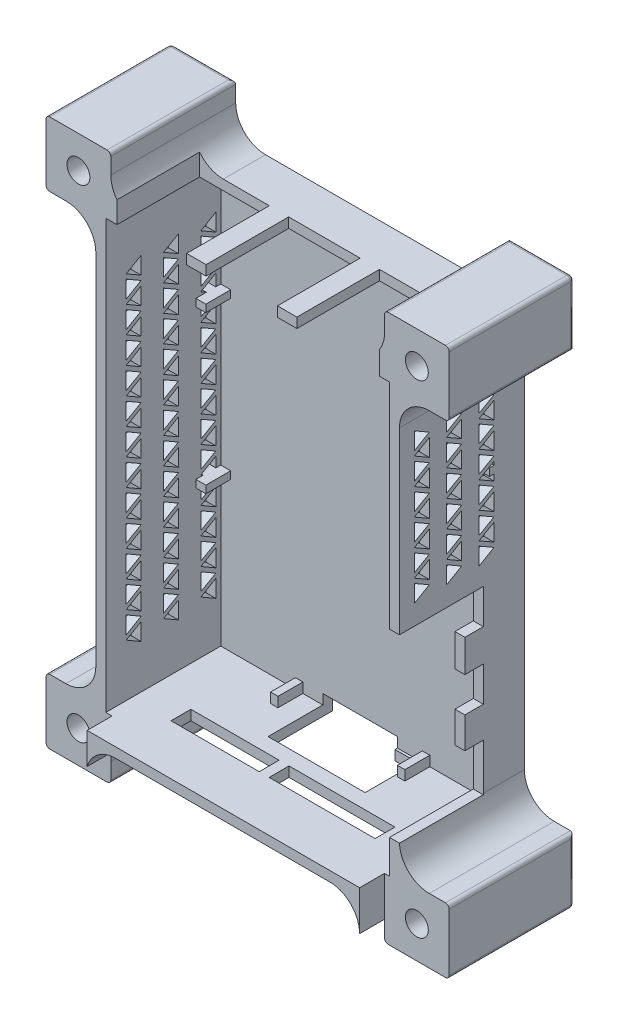
from build123d import *

# Parameters (mm, degrees)
SKETCH1_W            = 61
SKETCH1_H            = 90
BOSS_EXTRUDE1_DEPTH  = 2
SKETCH2_W            = 61
SKETCH2_H            = 90
SKETCH2_W_2          = 57
SKETCH2_H_2          = 86
BOSS_EXTRUDE2_DEPTH  = 6.6
SKETCH3_W            = 1.5
SKETCH3_H            = 2
SKETCH3_W_2          = 2
SKETCH3_H_2          = 1.5
BOSS_EXTRUDE3_DEPTH  = 5
SKETCH4_W            = 61
SKETCH4_H            = 90
SKETCH4_W_2          = 57
SKETCH4_H_2          = 86
BOSS_EXTRUDE4_DEPTH  = 16.5
SKETCH5_W            = 14.35
SKETCH5_H            = 16.6
SKETCH5_W_2          = 14
CUT_EXTRUDE1_DEPTH   = 2
SKETCH8_W            = 19.5
SKETCH8_H            = 10.5
SKETCH8_W_2          = 17.719958389
SKETCH8_H_2          = 4
SKETCH8_W_3          = 21.280041611
CUT_EXTRUDE3_DEPTH   = 2
CUT_EXTRUDE22_DEPTH  = 2
SKETCH10_W           = 61
SKETCH10_H           = 2
BOSS_EXTRUDE5_DEPTH  = 5
SKETCH20_W           = 13
SKETCH20_H           = 13
BOSS_EXTRUDE8_DEPTH  = 25.1
SKETCH25_W           = 13
SKETCH25_H           = 13
SKETCH25_W_2         = 0.25
CUT_EXTRUDE11_DEPTH  = 126.183904716
SKETCH26_W           = 1
SKETCH26_H           = 1
CUT_EXTRUDE12_DEPTH  = 23.1
SKETCH27_R           = 2.3
CUT_EXTRUDE13_DEPTH  = 126.183904716
CUT_EXTRUDE17_DEPTH  = 6
FILLET3_R            = 6
FILLET7_R            = 6
BOSS_EXTRUDE11_DEPTH = 25.1
SKETCH35_R           = 2.3
CUT_EXTRUDE18_DEPTH  = 126.183904716
FILLET10_R           = 6
FILLET13_R           = 0.75
CUT_EXTRUDE19_DEPTH  = 6
SKETCH38_W           = 11
SKETCH38_H           = 11
CUT_EXTRUDE20_DEPTH  = 10
FILLET14_R           = 6
SKETCH39_W           = 15
SKETCH39_H           = 2.5
CUT_EXTRUDE21_DEPTH  = 4
FILLET17_R           = 6
FILLET18_R           = 6
SKETCH43_W           = 3
SKETCH43_H           = 1.5
BOSS_EXTRUDE15_DEPTH = 2
CUT_EXTRUDE23_DEPTH  = 2
SKETCH44_W           = 0.9
SKETCH44_H           = 1.5
BOSS_EXTRUDE16_DEPTH = 2
FILLET19_R           = 6
FILLET20_R           = 6


with BuildPart() as part:
    # Sketch1 → Boss-Extrude1 (new body)
    with BuildSketch(Plane.XY):
        with Locations((30.5, 45)):
            Rectangle(SKETCH1_W, SKETCH1_H)
    extrude(amount=BOSS_EXTRUDE1_DEPTH)

    # Sketch2 → Boss-Extrude2 (add)
    with BuildSketch(Plane.XY.offset(2)):
        with Locations((30.5, 45)):
            Rectangle(SKETCH2_W, SKETCH2_H)
        with Locations((30.5, 45)):
            Rectangle(SKETCH2_W_2, SKETCH2_H_2, mode=Mode.SUBTRACT)
    extrude(amount=BOSS_EXTRUDE2_DEPTH)

    # Sketch3 → Boss-Extrude3 (add)
    with BuildSketch(Plane.XY.offset(2)):
        with Locations((43.25, 3)):
            Rectangle(SKETCH3_W, SKETCH3_H)
        with Locations((17.75, 3)):
            Rectangle(SKETCH3_W, SKETCH3_H)
        with Locations((3, 32.75)):
            Rectangle(SKETCH3_W_2, SKETCH3_H_2)
        with Locations((58, 32.75)):
            Rectangle(SKETCH3_W_2, SKETCH3_H_2)
        with Locations((58, 64.25)):
            Rectangle(SKETCH3_W_2, SKETCH3_H_2)
        with Locations((3, 64.25)):
            Rectangle(SKETCH3_W_2, SKETCH3_H_2)
    extrude(amount=BOSS_EXTRUDE3_DEPTH)

    # Sketch4 → Boss-Extrude4 (add)
    with BuildSketch(Plane.XY.offset(8.6)):
        with Locations((30.5, 45)):
            Rectangle(SKETCH4_W, SKETCH4_H)
        with Locations((30.5, 45)):
            Rectangle(SKETCH4_W_2, SKETCH4_H_2, mode=Mode.SUBTRACT)
    extrude(amount=BOSS_EXTRUDE4_DEPTH)

    # Sketch5 → Cut-Extrude1 (cut)
    with BuildSketch(Plane(origin=(0, 90, 0), x_dir=(1, 0, 0), z_dir=(0, 1, 0))):
        Polygon((57, -8.5), (40.4, -8.5), (40.4, -22.25), (40.4, -25.1), (57, -25.1), align=None)
        with Locations((29.325, -16.8)):
            Rectangle(SKETCH5_W, SKETCH5_H)
        with Locations((11.25, -16.8)):
            Rectangle(SKETCH5_W_2, SKETCH5_H)
    extrude(amount=-CUT_EXTRUDE1_DEPTH, mode=Mode.SUBTRACT)

    # Sketch8 → Cut-Extrude3 (cut)
    with BuildSketch(Plane(origin=(0, 0, 0), x_dir=(-1, 0, 0), z_dir=(0, -1, 0))):
        with Locations((-32.25, -7.75)):
            Rectangle(SKETCH8_W, SKETCH8_H)
        with Locations((-18.859979194, -18)):
            Rectangle(SKETCH8_W_2, SKETCH8_H_2)
        with Locations((-40.359979194, -18)):
            Rectangle(SKETCH8_W_3, SKETCH8_H_2)
    extrude(amount=-CUT_EXTRUDE3_DEPTH, mode=Mode.SUBTRACT)

    # Sketch9 → Cut-Extrude22 (cut)
    with BuildSketch(Plane.ZY):
        Polygon((3, 78), (6, 76.267949192), (3, 74.535898385), align=None)
        Polygon((3, 73.612137954), (6, 75.344188762), (6, 71.880087147), align=None)
        Polygon((10.5, 74.535898385), (10.5, 78), (13.5, 76.267949192), align=None)
        Polygon((13.5, 71.880087147), (10.5, 73.612137954), (13.5, 75.344188762), align=None)
        Polygon((18, 74.535898385), (18, 78), (21, 76.267949192), align=None)
        Polygon((21, 71.880087147), (18, 73.612137954), (21, 75.344188762), align=None)
        Polygon((10.5, 69.224275908), (10.5, 72.688377523), (13.5, 70.956326716), align=None)
        Polygon((13.5, 66.56846467), (10.5, 68.300515478), (13.5, 70.032566285), align=None)
        Polygon((18, 69.224275908), (18, 72.688377523), (21, 70.956326716), align=None)
        Polygon((21, 66.56846467), (18, 68.300515478), (21, 70.032566285), align=None)
        Polygon((10.5, 63.912653432), (10.5, 67.376755047), (13.5, 65.644704239), align=None)
        Polygon((13.5, 61.256842194), (10.5, 62.988893001), (13.5, 64.720943809), align=None)
        Polygon((18, 63.912653432), (18, 67.376755047), (21, 65.644704239), align=None)
        Polygon((21, 61.256842194), (18, 62.988893001), (21, 64.720943809), align=None)
        Polygon((10.5, 58.601030955), (10.5, 62.06513257), (13.5, 60.333081763), align=None)
        Polygon((13.5, 55.945219717), (10.5, 57.677270525), (13.5, 59.409321332), align=None)
        Polygon((18, 58.601030955), (18, 62.06513257), (21, 60.333081763), align=None)
        Polygon((21, 55.945219717), (18, 57.677270525), (21, 59.409321332), align=None)
        Polygon((10.5, 53.289408479), (10.5, 56.753510094), (13.5, 55.021459286), align=None)
        Polygon((13.5, 50.63359724), (10.5, 52.365648048), (13.5, 54.097698856), align=None)
        Polygon((18, 53.289408479), (18, 56.753510094), (21, 55.021459286), align=None)
        Polygon((21, 50.63359724), (18, 52.365648048), (21, 54.097698856), align=None)
        Polygon((10.5, 47.977786002), (10.5, 51.441887617), (13.5, 49.70983681), align=None)
        Polygon((13.5, 45.321974764), (10.5, 47.054025571), (13.5, 48.786076379), align=None)
        Polygon((18, 47.977786002), (18, 51.441887617), (21, 49.70983681), align=None)
        Polygon((21, 45.321974764), (18, 47.054025571), (21, 48.786076379), align=None)
        Polygon((10.5, 42.666163526), (10.5, 46.130265141), (13.5, 44.398214333), align=None)
        Polygon((13.5, 40.010352287), (10.5, 41.742403095), (13.5, 43.474453902), align=None)
        Polygon((18, 42.666163526), (18, 46.130265141), (21, 44.398214333), align=None)
        Polygon((21, 40.010352287), (18, 41.742403095), (21, 43.474453902), align=None)
        Polygon((10.5, 37.354541049), (10.5, 40.818642664), (13.5, 39.086591857), align=None)
        Polygon((13.5, 34.698729811), (10.5, 36.430780618), (13.5, 38.162831426), align=None)
        Polygon((18, 37.354541049), (18, 40.818642664), (21, 39.086591857), align=None)
        Polygon((21, 34.698729811), (18, 36.430780618), (21, 38.162831426), align=None)
        Polygon((10.5, 32.042918573), (10.5, 35.507020188), (13.5, 33.77496938), align=None)
        Polygon((13.5, 29.387107334), (10.5, 31.119158142), (13.5, 32.851208949), align=None)
        Polygon((18, 32.042918573), (18, 35.507020188), (21, 33.77496938), align=None)
        Polygon((21, 29.387107334), (18, 31.119158142), (21, 32.851208949), align=None)
        Polygon((10.5, 26.731296096), (10.5, 30.195397711), (13.5, 28.463346904), align=None)
        Polygon((13.5, 24.075484858), (10.5, 25.807535665), (13.5, 27.539586473), align=None)
        Polygon((18, 26.731296096), (18, 30.195397711), (21, 28.463346904), align=None)
        Polygon((21, 24.075484858), (18, 25.807535665), (21, 27.539586473), align=None)
        Polygon((10.5, 21.419673619), (10.5, 24.883775235), (13.5, 23.151724427), align=None)
        Polygon((13.5, 18.763862381), (10.5, 20.495913189), (13.5, 22.227963996), align=None)
        Polygon((18, 21.419673619), (18, 24.883775235), (21, 23.151724427), align=None)
        Polygon((21, 18.763862381), (18, 20.495913189), (21, 22.227963996), align=None)
        Polygon((10.5, 16.108051143), (10.5, 19.572152758), (13.5, 17.84010195), align=None)
        Polygon((13.5, 13.452239905), (10.5, 15.184290712), (13.5, 16.91634152), align=None)
        Polygon((18, 16.108051143), (18, 19.572152758), (21, 17.84010195), align=None)
        Polygon((21, 13.452239905), (18, 15.184290712), (21, 16.91634152), align=None)
        Polygon((10.5, 10.796428666), (10.5, 14.260530281), (13.5, 12.528479474), align=None)
        Polygon((18, 10.796428666), (18, 14.260530281), (21, 12.528479474), align=None)
        Polygon((3, 69.224275908), (3, 72.688377523), (6, 70.956326716), align=None)
        Polygon((6, 66.56846467), (3, 68.300515478), (6, 70.032566285), align=None)
        Polygon((3, 63.912653432), (3, 67.376755047), (6, 65.644704239), align=None)
        Polygon((6, 61.256842194), (3, 62.988893001), (6, 64.720943809), align=None)
        Polygon((3, 58.601030955), (3, 62.06513257), (6, 60.333081763), align=None)
        Polygon((6, 55.945219717), (3, 57.677270525), (6, 59.409321332), align=None)
        Polygon((3, 53.289408479), (3, 56.753510094), (6, 55.021459286), align=None)
        Polygon((6, 50.63359724), (3, 52.365648048), (6, 54.097698856), align=None)
        Polygon((3, 47.977786002), (3, 51.441887617), (6, 49.70983681), align=None)
        Polygon((6, 45.321974764), (3, 47.054025571), (6, 48.786076379), align=None)
        Polygon((3, 42.666163526), (3, 46.130265141), (6, 44.398214333), align=None)
        Polygon((6, 40.010352287), (3, 41.742403095), (6, 43.474453902), align=None)
        Polygon((3, 37.354541049), (3, 40.818642664), (6, 39.086591857), align=None)
        Polygon((6, 34.698729811), (3, 36.430780618), (6, 38.162831426), align=None)
        Polygon((3, 32.042918573), (3, 35.507020188), (6, 33.77496938), align=None)
        Polygon((6, 29.387107334), (3, 31.119158142), (6, 32.851208949), align=None)
        Polygon((3, 26.731296096), (3, 30.195397711), (6, 28.463346904), align=None)
        Polygon((6, 24.075484858), (3, 25.807535665), (6, 27.539586473), align=None)
        Polygon((3, 21.419673619), (3, 24.883775235), (6, 23.151724427), align=None)
        Polygon((6, 18.763862381), (3, 20.495913189), (6, 22.227963996), align=None)
        Polygon((3, 16.108051143), (3, 19.572152758), (6, 17.84010195), align=None)
        Polygon((6, 13.452239905), (3, 15.184290712), (6, 16.91634152), align=None)
        Polygon((3, 10.796428666), (3, 14.260530281), (6, 12.528479474), align=None)
    extrude(amount=-CUT_EXTRUDE22_DEPTH, mode=Mode.SUBTRACT)

    # Sketch10 → Boss-Extrude5 (add)
    with BuildSketch(Plane.XY.offset(25.1)):
        with Locations((30.5, 1)):
            Rectangle(SKETCH10_W, SKETCH10_H)
    extrude(amount=BOSS_EXTRUDE5_DEPTH)

    # Sketch20 → Boss-Extrude8 (add)
    with BuildSketch(Plane(origin=(0, 0, 0), x_dir=(-1, 0, 0), z_dir=(0, 0, -1))):
        with Locations((3.5, -3.5)):
            Rectangle(SKETCH20_W, SKETCH20_H)
        with Locations((-64.5, 93.5)):
            Rectangle(SKETCH20_W, SKETCH20_H)
    extrude(amount=-BOSS_EXTRUDE8_DEPTH)

    # Sketch25 → Cut-Extrude11 (cut, through all)
    with BuildSketch(Plane.XY.offset(25.1)):
        with Locations((-3.5, -3.5)):
            Rectangle(SKETCH25_W, SKETCH25_H)
        with Locations((3.125, -3.5)):
            Rectangle(SKETCH25_W_2, SKETCH25_H)
    extrude(amount=CUT_EXTRUDE11_DEPTH, mode=Mode.SUBTRACT)

    # Sketch26 → Cut-Extrude12 (cut)
    with BuildSketch(Plane.XY.offset(25.1)):
        with Locations((2.5, 2.5)):
            Rectangle(SKETCH26_W, SKETCH26_H)
        with Locations((58.5, 87.5)):
            Rectangle(SKETCH26_W, SKETCH26_H)
    extrude(amount=-CUT_EXTRUDE12_DEPTH, mode=Mode.SUBTRACT)

    # Sketch27 → Cut-Extrude13 (cut, through all)
    with BuildSketch(Plane.XY.offset(25.1)):
        with Locations((-3.5, -3.5)):
            Circle(SKETCH27_R)
        with Locations((64.5, 93.5)):
            Circle(SKETCH27_R)
    extrude(amount=-CUT_EXTRUDE13_DEPTH, mode=Mode.SUBTRACT)

    # Sketch31 → Cut-Extrude17 (cut)
    with BuildSketch(Plane(origin=(0, 0, 0), x_dir=(-1, 0, 0), z_dir=(0, 0, -1))):
        Polygon((-61.873056275, 88.95), (-59.24611255, 93.5), (-61.873056275, 98.05), (-67.126943725, 98.05), (-69.75388745, 93.5), (-67.126943725, 88.95), align=None)
        Polygon((6.126943725, -8.05), (8.75388745, -3.5), (6.126943725, 1.05), (0.873056275, 1.05), (-1.75388745, -3.5), (0.873056275, -8.05), align=None)
    extrude(amount=-CUT_EXTRUDE17_DEPTH, mode=Mode.SUBTRACT)

    # Fillet3
    fillet3_edges = [part.edges().sort_by_distance(p)[0] for p in [
        (58, 90, 12.55),
    ]]
    fillet(fillet3_edges, radius=FILLET3_R)

    # Fillet7
    fillet7_edges = [part.edges().sort_by_distance(p)[0] for p in [
        (3, 0, 12.55),
    ]]
    fillet(fillet7_edges, radius=FILLET7_R)

    # Sketch34 → Boss-Extrude11 (add)
    with BuildSketch(Plane.XY.offset(25.1)):
        Polygon((59, 3), (71, 3), (71, -10), (58, -10), (58, 2), (59, 2), align=None)
        Polygon((2, 87), (-10, 87), (-10, 100), (3, 100), (3, 88), (2, 88), align=None)
    extrude(amount=-BOSS_EXTRUDE11_DEPTH)

    # Sketch35 → Cut-Extrude18 (cut, through all)
    with BuildSketch(Plane.XY.offset(25.1)):
        with Locations((-3.5, 93.5)):
            Circle(SKETCH35_R)
        with Locations((64.5, -3.5)):
            Circle(SKETCH35_R)
    extrude(amount=-CUT_EXTRUDE18_DEPTH, mode=Mode.SUBTRACT)

    # Fillet10
    fillet10_edges = [part.edges().sort_by_distance(p)[0] for p in [
        (3, 90, 12.55),
    ]]
    fillet(fillet10_edges, radius=FILLET10_R)

    # Fillet13
    fillet13_edges = [part.edges().sort_by_distance(p)[0] for p in [
        (3, -10, 12.55),
        (-3.5, -10, 0),
        (-10, -3.5, 0),
        (-10, -10, 12.55),
        (-10, 3, 12.55),
        (58, 100, 12.55),
        (64.5, 100, 0),
        (71, 93.5, 0),
        (71, 100, 12.55),
        (71, 87, 12.55),
        (58, -10, 12.55),
        (64.5, -10, 0),
        (71, -10, 12.55),
        (71, -3.5, 0),
        (71, 3, 12.55),
        (3, 100, 12.55),
        (-3.5, 100, 0),
        (-10, 100, 12.55),
        (-10, 93.5, 0),
        (-10, 87, 12.55),
    ]]
    fillet(fillet13_edges, radius=FILLET13_R)

    # Sketch36 → Cut-Extrude19 (cut)
    with BuildSketch(Plane(origin=(0, 0, 0), x_dir=(-1, 0, 0), z_dir=(0, 0, -1))):
        Polygon((-59.24611255, -3.5), (-61.873056275, 1.05), (-67.126943725, 1.05), (-69.75388745, -3.5), (-67.126943725, -8.05), (-61.873056275, -8.05), align=None)
        Polygon((-1.75388745, 93.5), (0.873056275, 88.95), (6.126943725, 88.95), (8.75388745, 93.5), (6.126943725, 98.05), (0.873056275, 98.05), align=None)
    extrude(amount=-CUT_EXTRUDE19_DEPTH, mode=Mode.SUBTRACT)

    # Sketch38 → Cut-Extrude20 (cut)
    with BuildSketch(Plane.XY.offset(25.1)):
        with Locations((63.5, -2.5)):
            Rectangle(SKETCH38_W, SKETCH38_H)
    extrude(amount=CUT_EXTRUDE20_DEPTH, mode=Mode.SUBTRACT)

    # Fillet14
    # the kernel refuses this fillet: 6 mm, written as the material it adds along each edge
    with BuildSketch(Plane(origin=(58, 0, 40.1), x_dir=(0, -1, 0), z_dir=(0, 0, -1))) as fillet14_piece_1_section:
        with BuildLine():
            CenterArc((FILLET14_R, FILLET14_R), FILLET14_R, 180, 90)
            Line((0, FILLET14_R), (0, 0))
            Line((0, 0), (FILLET14_R, 0))
        make_face()
    fillet14_piece_1 = extrude(amount=40.1, mode=Mode.PRIVATE)
    fillet14_piece_1 = split(fillet14_piece_1, bisect_by=Plane(origin=(56.518293699, -1.220838778, 25.1), z_dir=(0, 0, 1)), keep=Keep.TOP, mode=Mode.PRIVATE)
    fillet14_piece_1 = split(fillet14_piece_1, bisect_by=Plane(origin=(58, -1.220838778, 27.6), z_dir=(-1, 0, 0)), keep=Keep.TOP, mode=Mode.PRIVATE)
    fillet14_piece_1 = split(fillet14_piece_1, bisect_by=Plane(origin=(56.518293699, -1.220838778, 30.1), z_dir=(0, 0, -1)), keep=Keep.TOP, mode=Mode.PRIVATE)
    add(fillet14_piece_1)
    with BuildSketch(Plane(origin=(58, 0, 25.1), x_dir=(0, -1, 0), z_dir=(0, 0, -1))) as fillet14_piece_2_section:
        with BuildLine():
            CenterArc((FILLET14_R, FILLET14_R), FILLET14_R, 180, 90)
            Line((0, FILLET14_R), (0, 0))
            Line((0, 0), (FILLET14_R, 0))
        make_face()
    fillet14_piece_2 = extrude(amount=25.1, mode=Mode.PRIVATE)
    fillet14_piece_2 = split(fillet14_piece_2, bisect_by=Plane(origin=(58, -1.220838778, 12.55), z_dir=(-1, 0, 0)), keep=Keep.TOP, mode=Mode.PRIVATE)
    add(fillet14_piece_2)

    # Sketch39 → Cut-Extrude21 (cut)
    with BuildSketch(Plane.XZ):
        with Locations((30, 1.25)):
            Rectangle(SKETCH39_W, SKETCH39_H)
    extrude(amount=-CUT_EXTRUDE21_DEPTH, mode=Mode.SUBTRACT)

    # Fillet17
    fillet17_edges = [part.edges().sort_by_distance(p)[0] for p in [
        (0, 87, 12.55),
    ]]
    fillet(fillet17_edges, radius=FILLET17_R)

    # Fillet18
    fillet18_edges = [part.edges().sort_by_distance(p)[0] for p in [
        (0, 3, 12.55),
    ]]
    fillet(fillet18_edges, radius=FILLET18_R)

    # Sketch43 → Boss-Extrude15 (add)
    with BuildSketch(Plane.ZY):
        with Locations((4.5, 32.75)):
            Rectangle(SKETCH43_W, SKETCH43_H)
        with Locations((4.5, 64.25)):
            Rectangle(SKETCH43_W, SKETCH43_H)
    extrude(amount=-BOSS_EXTRUDE15_DEPTH)

    # Sketch7 → Cut-Extrude23 (cut)
    with BuildSketch(Plane(origin=(61, 0, 0), x_dir=(0, 0, -1), z_dir=(1, 0, 0))):
        Polygon((-11.95, 18.25), (-11.95, 24.5), (-8.25, 24.5), (-8.25, 31.5), (-11.95, 31.5), (-11.95, 38), (-8.25, 38), (-8.25, 45), (-25.1, 45), (-25.1, 8.75), (-8.25, 8.75), (-8.25, 18.25), align=None)
        Polygon((-22.1, 79), (-19.1, 77.267949192), (-22.1, 75.535898385), align=None)
        Polygon((-22.1, 74.612137955), (-19.1, 76.344188762), (-19.1, 72.880087147), align=None)
        Polygon((-15.6, 75.535898385), (-15.6, 79), (-12.6, 77.267949192), align=None)
        Polygon((-12.6, 72.880087147), (-15.6, 74.612137955), (-12.6, 76.344188762), align=None)
        Polygon((-9.1, 75.535898385), (-9.1, 79), (-6.1, 77.267949192), align=None)
        Polygon((-6.1, 72.880087147), (-9.1, 74.612137955), (-6.1, 76.344188762), align=None)
        Polygon((-15.6, 70.22427591), (-15.6, 73.688377525), (-12.6, 71.956326717), align=None)
        Polygon((-12.6, 67.568464672), (-15.6, 69.30051548), (-12.6, 71.032566287), align=None)
        Polygon((-9.1, 70.22427591), (-9.1, 73.688377525), (-6.1, 71.956326717), align=None)
        Polygon((-6.1, 67.568464672), (-9.1, 69.30051548), (-6.1, 71.032566287), align=None)
        Polygon((-15.6, 64.912653435), (-15.6, 68.37675505), (-12.6, 66.644704242), align=None)
        Polygon((-12.6, 62.256842197), (-15.6, 63.988893005), (-12.6, 65.720943812), align=None)
        Polygon((-9.1, 64.912653435), (-9.1, 68.37675505), (-6.1, 66.644704242), align=None)
        Polygon((-6.1, 62.256842197), (-9.1, 63.988893005), (-6.1, 65.720943812), align=None)
        Polygon((-15.6, 59.601030959), (-15.6, 63.065132575), (-12.6, 61.333081767), align=None)
        Polygon((-12.6, 56.945219722), (-15.6, 58.677270529), (-12.6, 60.409321337), align=None)
        Polygon((-9.1, 59.601030959), (-9.1, 63.065132575), (-6.1, 61.333081767), align=None)
        Polygon((-6.1, 56.945219722), (-9.1, 58.677270529), (-6.1, 60.409321337), align=None)
        Polygon((-15.6, 54.289408484), (-15.6, 57.753510099), (-12.6, 56.021459292), align=None)
        Polygon((-12.6, 51.633597247), (-15.6, 53.365648054), (-12.6, 55.097698862), align=None)
        Polygon((-9.1, 54.289408484), (-9.1, 57.753510099), (-6.1, 56.021459292), align=None)
        Polygon((-6.1, 51.633597247), (-9.1, 53.365648054), (-6.1, 55.097698862), align=None)
        Polygon((-15.6, 48.977786009), (-15.6, 52.441887624), (-12.6, 50.709836817), align=None)
        Polygon((-9.1, 48.977786009), (-9.1, 52.441887624), (-6.1, 50.709836817), align=None)
        Polygon((-22.1, 70.22427591), (-22.1, 73.688377525), (-19.1, 71.956326717), align=None)
        Polygon((-19.1, 67.568464672), (-22.1, 69.30051548), (-19.1, 71.032566287), align=None)
        Polygon((-22.1, 64.912653435), (-22.1, 68.37675505), (-19.1, 66.644704242), align=None)
        Polygon((-19.1, 62.256842197), (-22.1, 63.988893005), (-19.1, 65.720943812), align=None)
        Polygon((-22.1, 59.601030959), (-22.1, 63.065132575), (-19.1, 61.333081767), align=None)
        Polygon((-19.1, 56.945219722), (-22.1, 58.677270529), (-19.1, 60.409321337), align=None)
        Polygon((-22.1, 54.289408484), (-22.1, 57.753510099), (-19.1, 56.021459292), align=None)
        Polygon((-19.1, 51.633597247), (-22.1, 53.365648054), (-19.1, 55.097698862), align=None)
        Polygon((-22.1, 48.977786009), (-22.1, 52.441887624), (-19.1, 50.709836817), align=None)
    extrude(amount=-CUT_EXTRUDE23_DEPTH, mode=Mode.SUBTRACT)

    # Sketch44 → Boss-Extrude16 (add)
    with BuildSketch(Plane(origin=(61, 0, 0), x_dir=(0, 0, -1), z_dir=(1, 0, 0))):
        with Locations((-6.55, 64.25)):
            Rectangle(SKETCH44_W, SKETCH44_H)
    extrude(amount=-BOSS_EXTRUDE16_DEPTH)

    # Fillet19
    fillet19_edges = [part.edges().sort_by_distance(p)[0] for p in [
        (61, 3, 12.55),
    ]]
    fillet(fillet19_edges, radius=FILLET19_R)

    # Fillet20
    fillet20_edges = [part.edges().sort_by_distance(p)[0] for p in [
        (61, 87, 12.55),
    ]]
    fillet(fillet20_edges, radius=FILLET20_R)


solid = part.part
